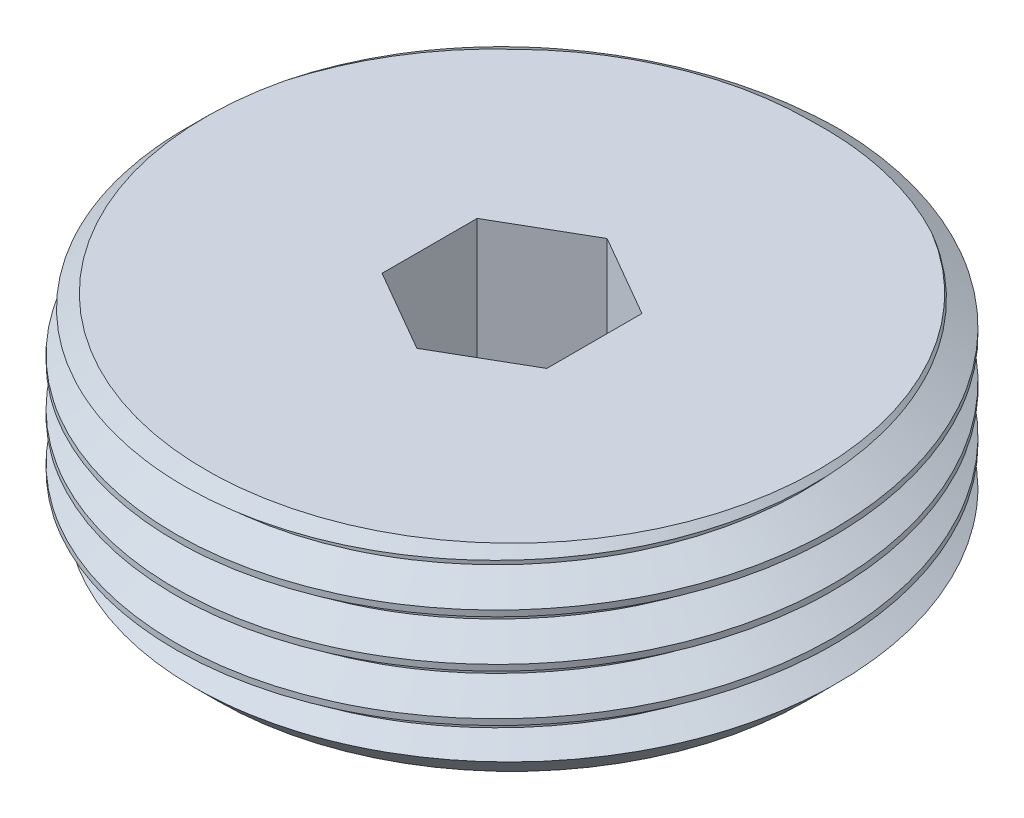
from build123d import *

# Parameters (mm, degrees)
SKETCH1_R          = 12.7
EXTRUDE1_DEPTH     = 7.9375
CHAMFER1_SIZE      = 1.360714286
CHAMFER2_SIZE      = 0.907142857
CUT_SWEEP1_PITCH   = 1.814285714
CUT_EXTRUDE1_DEPTH = 20.636290712


with BuildPart() as part:
    # Sketch1 → Extrude1 (new body)
    with BuildSketch(Plane(origin=(0, 0, 0), x_dir=(1, 0, 0), z_dir=(0, 1, 0))):
        with Locations(Location((0, 0, 0), (0, 0, 270))):
            Circle(SKETCH1_R)
    extrude(amount=-EXTRUDE1_DEPTH)

    # Chamfer1
    chamfer1_edges = [part.edges().sort_by_distance(p)[0] for p in [
        (0, -7.9375, -12.7),
    ]]
    chamfer(chamfer1_edges, length=CHAMFER1_SIZE)

    # Chamfer2
    chamfer2_edges = [part.edges().sort_by_distance(p)[0] for p in [
        (0, 0, -12.7),
    ]]
    chamfer(chamfer2_edges, length=CHAMFER2_SIZE)

    # Cut-Sweep1: the profile of Sketch3 profile screwed along a right-hand helix of 5.375 turns, 6 arcs to a turn; built about Z, then put on its axis
    cut_sweep1_z = Axis((0, 0, 0), (0, 0, 1))
    cut_sweep1_corners = [(12.7003, 0, 0.000173205), (11.521586861, 0, -0.680357143), (11.521586861, 0, -0.907142857), (12.7003, 0, -1.587673205)]
    with BuildLine(mode=Mode.PRIVATE) as cut_sweep1_profile:
        Line(cut_sweep1_corners[0], cut_sweep1_corners[1])
        Line(cut_sweep1_corners[1], cut_sweep1_corners[2])
        Line(cut_sweep1_corners[2], cut_sweep1_corners[3])
        Line(cut_sweep1_corners[3], cut_sweep1_corners[0])
    cut_sweep1_cap = Face(cut_sweep1_profile.wire())
    cut_sweep1_turn_angles = [0, 30, 60, 90, 120, 150, 180, 210, 240, 270, 300, 330, 360]
    cut_sweep1_turn_weights = [1, 0.8660254037844387, 1, 0.8660254037844387, 1, 0.8660254037844387, 1, 0.8660254037844387, 1, 0.8660254037844387, 1, 0.8660254037844387, 1]
    cut_sweep1_turn_rails = [Edge.make_bspline([Vector(p[0], p[1], 0).rotate(cut_sweep1_z, cut_sweep1_turn_angles[k]) / cut_sweep1_turn_weights[k] + Vector(0, 0, p[2] + CUT_SWEEP1_PITCH * cut_sweep1_turn_angles[k] / 360) for k in range(13)], [0, 0, 0, 1, 1, 2, 2, 3, 3, 4, 4, 5, 5, 6, 6, 6], 2, cut_sweep1_turn_weights) for p in cut_sweep1_corners]
    cut_sweep1_turn_sides = [Face.make_surface_from_curves(cut_sweep1_turn_rails[p[0]], cut_sweep1_turn_rails[p[1]]) for p in [(0, 1), (1, 2), (2, 3), (3, 0)]]
    cut_sweep1_last_angles = [1800, 1830, 1860, 1890, 1920, 1927.5, 1935]
    cut_sweep1_last_weights = [1, 0.8660254037844387, 1, 0.8660254037844387, 1, 0.991444861373807, 1]
    cut_sweep1_last_rails = [Edge.make_bspline([Vector(p[0], p[1], 0).rotate(cut_sweep1_z, cut_sweep1_last_angles[k]) / cut_sweep1_last_weights[k] + Vector(0, 0, p[2] + CUT_SWEEP1_PITCH * cut_sweep1_last_angles[k] / 360) for k in range(7)], [0, 0, 0, 1, 1, 2, 2, 3, 3, 3], 2, cut_sweep1_last_weights) for p in cut_sweep1_corners]
    cut_sweep1_last_sides = [Face.make_surface_from_curves(cut_sweep1_last_rails[p[0]], cut_sweep1_last_rails[p[1]]) for p in [(0, 1), (1, 2), (2, 3), (3, 0)]]
    cut_sweep1 = Plane(origin=(0, 0, 0), x_dir=(0, 0, 1), z_dir=(0, -1, 0)) * Solid(Shell([*[p.moved(Location((0, 0, CUT_SWEEP1_PITCH * i))) for i in range(5) for p in cut_sweep1_turn_sides], *cut_sweep1_last_sides, cut_sweep1_cap, cut_sweep1_cap.rotate(cut_sweep1_z, 1935).moved(Location((0, 0, CUT_SWEEP1_PITCH * 1935 / 360)))]))
    add(cut_sweep1, mode=Mode.SUBTRACT)

    # Sketch4 → Cut-Extrude1 (cut, through all)
    with BuildSketch(Plane(origin=(0, 0, 0), x_dir=(1, 0, 0), z_dir=(0, 1, 0))):
        Polygon((0, 3.666174209), (-3.175, 1.833087105), (-3.175, -1.833087105), (0, -3.666174209), (3.175, -1.833087105), (3.175, 1.833087105), align=None)
    extrude(amount=-CUT_EXTRUDE1_DEPTH, mode=Mode.SUBTRACT)


solid = part.part
